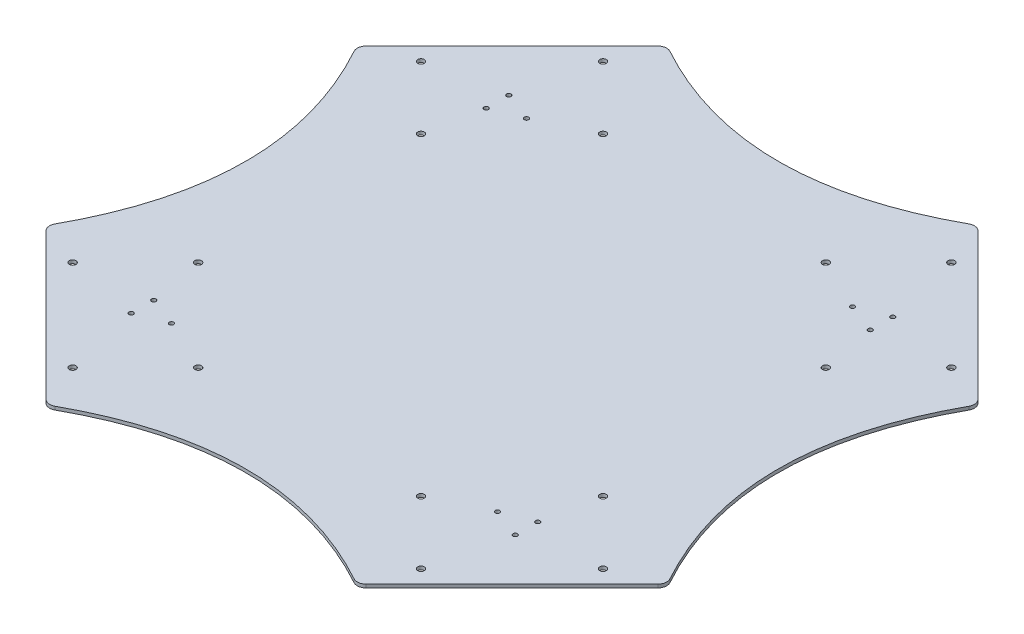
from build123d import *

# Parameters (mm, degrees)
DODANIE_WYCI_GNI_CIE1_DEPTH = 1.5
ZAOKR_GLENIE1_R             = 4
SZKIC2_R                    = 1.5
WYTNIJ_WYCI_GNI_CIE1_DEPTH  = 197.62293997
SZYK_KO_OWY1_COUNT          = 4
SZKIC3_R                    = 1
WYTNIJ_WYCI_GNI_CIE2_DEPTH  = 197.62293997
SZYK_KO_OWY2_OUTLINE_R      = 1
SZYK_KO_OWY2_DEPTH          = 1.5


# Read off the part's stored shape, not the designer's step: Szyk kołowy2
with BuildPart() as part:
    # Szkic1 → Dodanie-wyciągnięcie1 (new body)
    with BuildSketch(Plane(origin=(0, 0, 0), x_dir=(1, 0, 0), z_dir=(0, 1, 0))):
        with BuildLine():
            Line((-70, -140), (-140, -70))
            add(Edge.make_bspline(
                [(-140, 70), (-100, 0), (-140, -70)],
                knots=[0, 0, 0, 1, 1, 1], degree=2))
            Line((-140, 70), (-70, 140))
            add(Edge.make_bspline(
                [(70, 140), (0, 100), (-70, 140)],
                knots=[0, 0, 0, 1, 1, 1], degree=2))
            Line((70, 140), (140, 70))
            add(Edge.make_bspline(
                [(140, -70), (100, 0), (140, 70)],
                knots=[0, 0, 0, 1, 1, 1], degree=2))
            Line((140, -70), (70, -140))
            add(Edge.make_bspline(
                [(-70, -140), (0, -100), (70, -140)],
                knots=[0, 0, 0, 1, 1, 1], degree=2))
        make_face()
    extrude(amount=DODANIE_WYCI_GNI_CIE1_DEPTH)

    # Zaokrąglenie1
    zaokr_glenie1_edges = [part.edges().sort_by_distance(p)[0] for p in [
        (-140, 0.75, -70),
        (-70, 0.75, -140),
        (70, 0.75, -140),
        (140, 0.75, -70),
        (140, 0.75, 70),
        (70, 0.75, 140),
        (-140, 0.75, 70),
        (-70, 0.75, 140),
    ]]
    fillet(zaokr_glenie1_edges, radius=ZAOKR_GLENIE1_R)

    # Szkic2 → Wytnij-wyciągnięcie1 (cut, through all)
    with BuildSketch(Plane(origin=(0, 1.5, 0), x_dir=(1, 0, 0), z_dir=(0, 1, 0))):
        with Locations(Location((-78.488852712, -119.501046021, 0), (0, 0, 270))):
            Circle(SZKIC2_R)
        with Locations(Location((-119.501046021, -78.488852712, 0), (0, 0, 90))):
            Circle(SZKIC2_R)
        with Locations(Location((-50.204581464, -91.216774773, 0), (0, 0, 90))):
            Circle(SZKIC2_R)
        with Locations(Location((-91.216774773, -50.204581464, 0), (0, 0, 270))):
            Circle(SZKIC2_R)
    wytnij_wyci_gni_cie1 = extrude(amount=-WYTNIJ_WYCI_GNI_CIE1_DEPTH, mode=Mode.SUBTRACT)

    # Szyk kołowy1: Wytnij-wyciągnięcie1 ×4 about axis
    szyk_ko_owy1_axis = Axis((0, 0, 0), (0, 1, 0))
    for i in range(1, SZYK_KO_OWY1_COUNT):
        add(wytnij_wyci_gni_cie1.rotate(szyk_ko_owy1_axis, i * 360 / SZYK_KO_OWY1_COUNT), mode=Mode.SUBTRACT)

    # Szkic3 → Wytnij-wyciągnięcie2 (cut, through all)
    with BuildSketch(Plane(origin=(0, 1.5, 0), x_dir=(1, 0, 0), z_dir=(0, 1, 0))):
        with Locations(Location((-86.525, -85.085, 0), (0, 0, 270))):
            Circle(SZKIC3_R)
        with Locations(Location((-73.475, -80, 0), (0, 0, 270))):
            Circle(SZKIC3_R)
        with Locations(Location((-86.525, -74.915, 0), (0, 0, 90))):
            Circle(SZKIC3_R)
    wytnij_wyci_gni_cie2 = extrude(amount=-WYTNIJ_WYCI_GNI_CIE2_DEPTH, mode=Mode.SUBTRACT)

    # Lustro1: Wytnij-wyciągnięcie2 across plane
    add(wytnij_wyci_gni_cie2.mirror(Plane(origin=(0, 0, 0), x_dir=(0, 0, 1), z_dir=(1, 0, 0))), mode=Mode.SUBTRACT)

    # Szyk kołowy2 outline → Szyk kołowy2 (cut)
    with BuildSketch(Plane(origin=(0, 0, 0), x_dir=(1, 0, 0), z_dir=(0, 1, 0))):
        with Locations((-86.525, 74.915)):
            Circle(SZYK_KO_OWY2_OUTLINE_R)
        with Locations((-73.475, 80)):
            Circle(SZYK_KO_OWY2_OUTLINE_R)
        with Locations((-86.525, 85.085)):
            Circle(SZYK_KO_OWY2_OUTLINE_R)
        with Locations((86.525, 85.085)):
            Circle(SZYK_KO_OWY2_OUTLINE_R)
        with Locations((86.525, 74.915)):
            Circle(SZYK_KO_OWY2_OUTLINE_R)
        with Locations((73.475, 80)):
            Circle(SZYK_KO_OWY2_OUTLINE_R)
    extrude(amount=SZYK_KO_OWY2_DEPTH, mode=Mode.SUBTRACT)


solid = part.part
